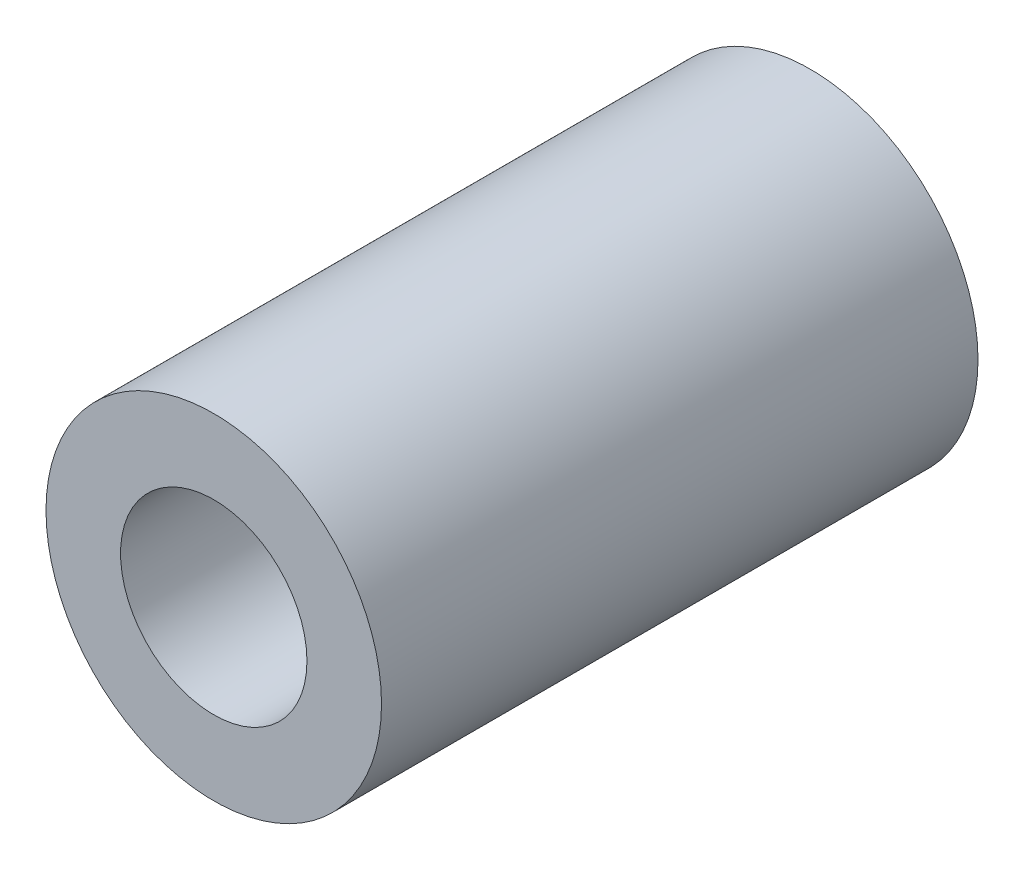
from build123d import *

# Parameters (mm, degrees)
ESBO_O1_R                = 13.5
ESBO_O1_R_2              = 7.5
RESSALTO_EXTRUS_O1_DEPTH = 48


with BuildPart() as part:
    # Esboço1 → Ressalto-extrusão1 (new body)
    with BuildSketch(Plane.XY):
        Circle(ESBO_O1_R)
        Circle(ESBO_O1_R_2, mode=Mode.SUBTRACT)
    extrude(amount=RESSALTO_EXTRUS_O1_DEPTH)


solid = part.part
